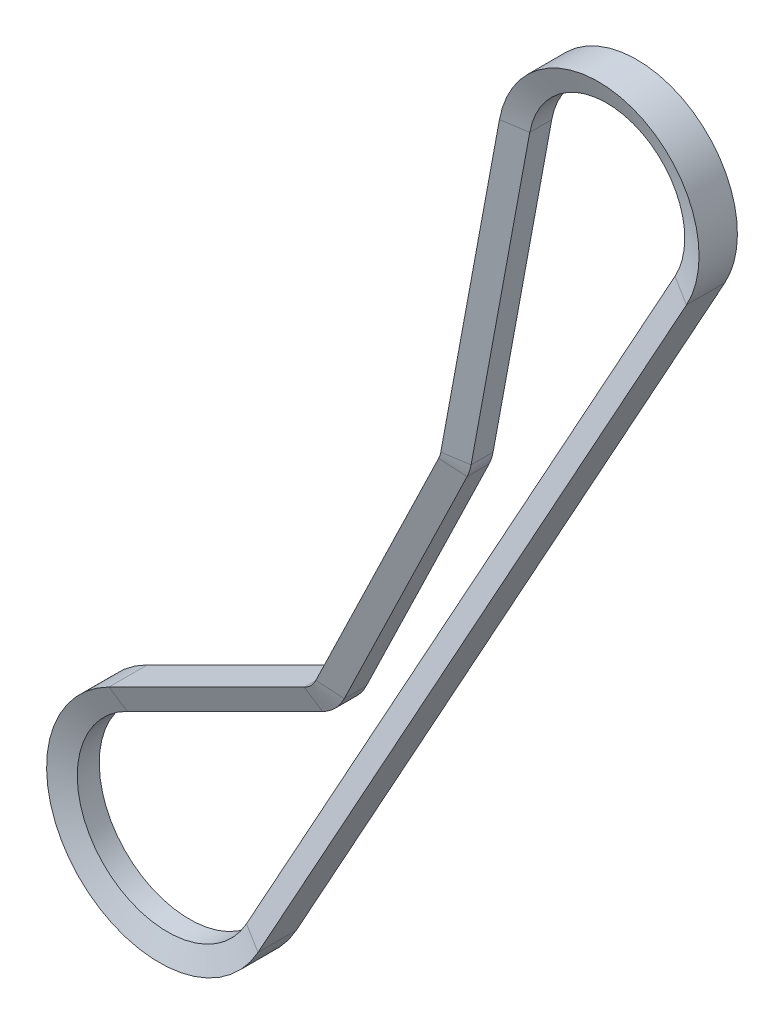
from build123d import *


with BuildPart() as part:
    # Sweep1: sweep along a path in Sketch2
    with BuildLine(Plane.XY) as sweep1_path:
        Line((21.878345212, -12.097024872), (-84.565575639, -204.608561446))
        ThreePointArc((-84.565575639, -204.608561446), (-129.281845201, -210.436526863), (-121.571627048, -166.006103947))
        Line((-121.571627048, -166.006103947), (-73.061985858, -141.79889509))
        ThreePointArc((-73.061985858, -141.79889509), (-71.380358978, -140.580177194), (-70.181895061, -138.884056175))
        Line((-70.181895061, -138.884056175), (-39.679503493, -75.879261844))
        ThreePointArc((-39.679503493, -75.879261844), (-39.360976368, -75.090592346), (-39.150709515, -74.266427947))
        Line((-39.150709515, -74.266427947), (-24.583578316, 4.54397152))
        ThreePointArc((-24.583578316, 4.54397152), (8.429724893, 23.535924418), (21.878345212, -12.097024872))
    # Sketch3 → Sweep1 (sweep)
    with BuildSketch(Plane(origin=(-24.583578316, 4.54397152, 0), x_dir=(0.9833431326447478, -0.18175886080302678, 0), z_dir=(0.18175886080302678, 0.9833431326447478, 0))):
        Polygon((0, -4.7625), (0, 4.7625), (5.588, 2.728634331), (5.588, -2.728634331), align=None)
    sweep(path=sweep1_path.line)


solid = part.part
